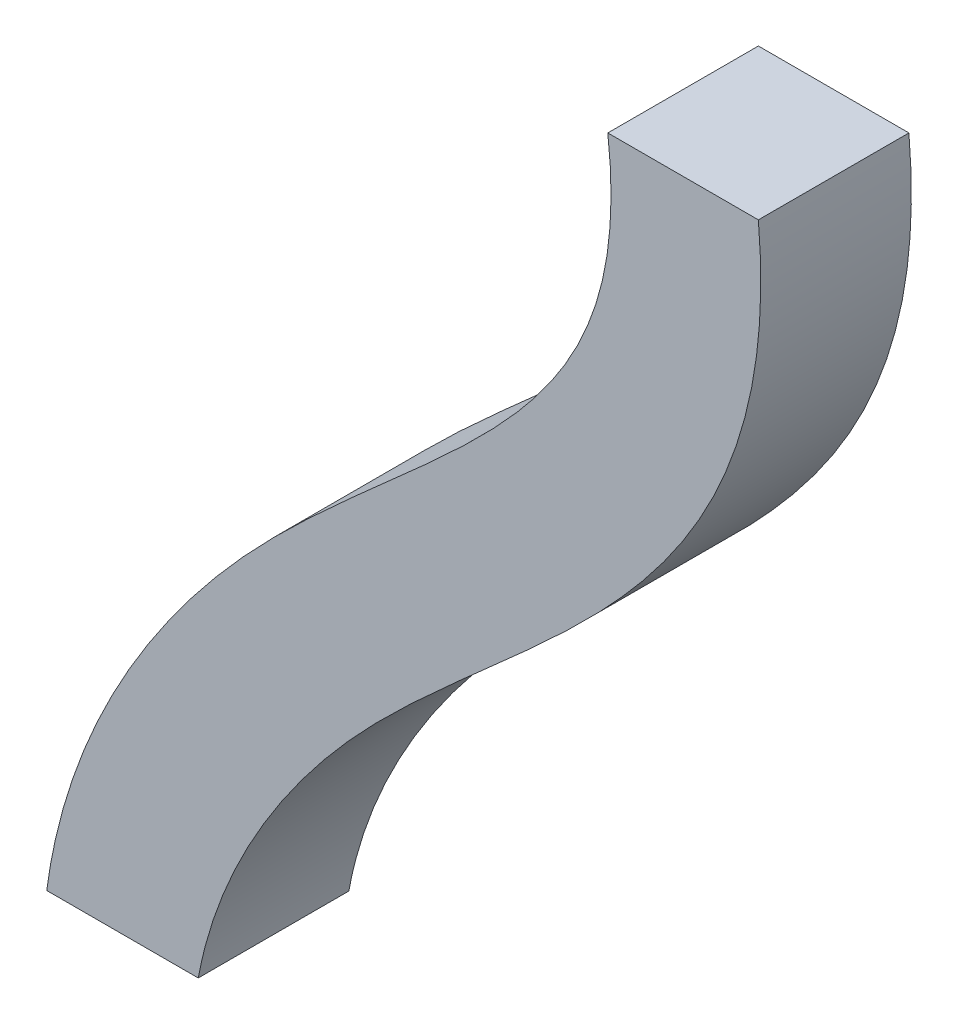
from build123d import *

# Parameters (mm, degrees)
SWEEP_START              = -39.51527456
SWEEP_8_DEPTH            = 70
CUT_EXTRUDE_1_DEPTH      = 775.119381415
CUT_EXTRUDE_1_DEPTH_BACK = 1000
SKETCH_14_W              = 412.900617981
SKETCH_14_H              = 48.735578835
SKETCH_14_W_2            = 392.900617981
SKETCH_14_H_2            = 28.735578835


# Read off the part's stored shape, not the designer's step: 扫描8
with BuildPart() as part:
    # 扫描8 outline → 扫描8 (new body)
    with BuildSketch(Plane.XY.offset(SWEEP_START)):
        with BuildLine():
            add(Edge.make_bspline(
                [(611.74177279, 0), (613.562905225, -20.061647212), (613.140483384, -38.97389472), (608.22799564, -74.491585311), (603.732053663, -91.082382902), (591.565592027, -121.802907269), (583.9141797, -135.921385393), (566.634432132, -161.975824337), (557.014345367, -173.923920184), (536.758260824, -196.324927261), (526.117626199, -206.785924759), (504.521198396, -226.919183017), (493.561726757, -236.592745768), (471.93414929, -255.741582394), (461.265673609, -265.216217079), (440.796524994, -284.446980973), (430.997740472, -294.201320957), (410.786079495, -316.61560512), (400.438823277, -329.681936911), (382.067591567, -356.794632727), (374.045977449, -370.839740148), (361.025054863, -399.351363376), (356.0280253, -413.811599267), (349.565825431, -442.653097808), (348.093872619, -457.03128295), (348.561130912, -471.270604447)],
                knots=[0, 0, 0, 0, 0.077645882, 0.077645882, 0.155291763, 0.155291763, 0.232937645, 0.232937645, 0.310583526, 0.310583526, 0.388229408, 0.388229408, 0.465875289, 0.465875289, 0.543521171, 0.543521171, 0.621167053, 0.621167053, 0.715875289, 0.715875289, 0.810583526, 0.810583526, 0.905291763, 0.905291763, 1, 1, 1, 1], degree=3))
            Line((611.74177279, 0), (541.74177279, 0))
            add(Edge.make_bspline(
                [(541.74177279, 0), (543.564152195, -15.269528182), (543.65824021, -28.82081106), (541.217260508, -53.505194451), (538.687917708, -64.6531188), (531.352692177, -85.69678154), (526.527702124, -95.603768577), (514.649511843, -114.89837648), (507.588063148, -124.273862324), (491.52192821, -142.829508474), (482.52187882, -152.001582509), (463.123774553, -170.455330471), (452.729398142, -179.735702409), (431.182100001, -198.82697163), (420.029548121, -208.638508101), (397.63544663, -229.323696303), (386.392008606, -240.199137256), (362.142543771, -266.191454308), (349.564722419, -281.476299366), (326.690089811, -313.837794757), (316.390917174, -330.915701707), (298.966406943, -366.690086014), (291.838790441, -385.392843292), (281.839688743, -424.185451174), (278.975285414, -444.278374115), (278.86099248, -464.798301725)],
                knots=[0, 0, 0, 0, 0.077645882, 0.077645882, 0.155291763, 0.155291763, 0.232937645, 0.232937645, 0.310583526, 0.310583526, 0.388229408, 0.388229408, 0.465875289, 0.465875289, 0.543521171, 0.543521171, 0.621167053, 0.621167053, 0.715875289, 0.715875289, 0.810583526, 0.810583526, 0.905291763, 0.905291763, 1, 1, 1, 1], degree=3))
            Line((278.86099248, -464.798301725), (348.561130912, -471.270604447))
        make_face()
    extrude(amount=SWEEP_8_DEPTH)

    # 草图14 → 切除-拉伸-薄壁1 (cut, two sides: drawn at the far end of the back side and taken through both)
    with BuildSketch(Plane.XY.offset(-CUT_EXTRUDE_1_DEPTH_BACK)):
        with Locations((405.2914638, -459.858534228)):
            Rectangle(SKETCH_14_W, SKETCH_14_H)
        with Locations((405.2914638, -459.858534228)):
            Rectangle(SKETCH_14_W_2, SKETCH_14_H_2, mode=Mode.SUBTRACT)
    extrude(amount=CUT_EXTRUDE_1_DEPTH + CUT_EXTRUDE_1_DEPTH_BACK, mode=Mode.SUBTRACT)


with BuildPart() as body_2:
    # of the pieces the cut leaves, the one that is kept (cut_extrude_1_keep)
    add(part.part.solids().sort_by_distance((611.74177279, 0, -39.51527456))[0])


solid = body_2.part
